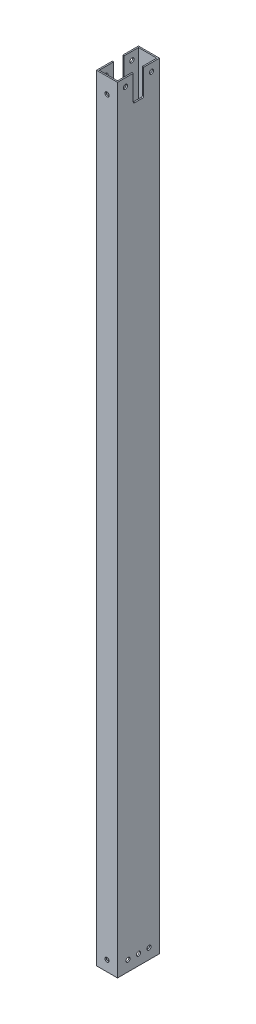
from build123d import *

# Parameters (mm, degrees)
SKETCH1_W              = 25.4
SKETCH1_H              = 50.8
SKETCH1_W_2            = 22.225
SKETCH1_H_2            = 47.625
EXTRUDE_THIN1_DEPTH    = 939.8
CUT_EXTRUDE1_DEPTH     = 941.486235944
F_10_CLEARANCE_HOLE1_D = 5.1054
F_10_CLEARANCE_HOLE2_D = 5.1054


with BuildPart() as part:
    # Sketch1 → Extrude-Thin1 (new body)
    with BuildSketch(Plane(origin=(0, 0, 0), x_dir=(1, 0, 0), z_dir=(0, 1, 0))):
        Rectangle(SKETCH1_W, SKETCH1_H)
        Rectangle(SKETCH1_W_2, SKETCH1_H_2, mode=Mode.SUBTRACT)
    extrude(amount=EXTRUDE_THIN1_DEPTH)

    # Sketch2 → Cut-Extrude1 (cut, through all)
    with BuildSketch(Plane.ZY.offset(12.7)):
        with BuildLine():
            Line((-6.35, 939.8), (6.35, 939.8))
            Line((6.35, 939.8), (6.35, 909.828))
            ThreePointArc((6.35, 909.828), (5.829235857, 908.570764143), (4.572, 908.05))
            Line((4.572, 908.05), (-4.572, 908.05))
            ThreePointArc((-4.572, 908.05), (-5.829235857, 908.570764143), (-6.35, 909.828))
            Line((-6.35, 909.828), (-6.35, 939.8))
        make_face()
    extrude(amount=-CUT_EXTRUDE1_DEPTH, mode=Mode.SUBTRACT)

    # #10 Clearance Hole1 (through all)
    with Locations(Plane.XY.offset(25.4)):
        with Locations((0, 920.75), (0, 12.7)):
            Hole(F_10_CLEARANCE_HOLE1_D / 2)

    # #10 Clearance Hole2 (through all)
    with Locations(Plane.ZY.offset(12.7)):
        with Locations((15.875, 930.275), (-15.875, 930.275), (-12.7, 12.7), (0, 12.7), (12.7, 12.7)):
            Hole(F_10_CLEARANCE_HOLE2_D / 2)


solid = part.part
